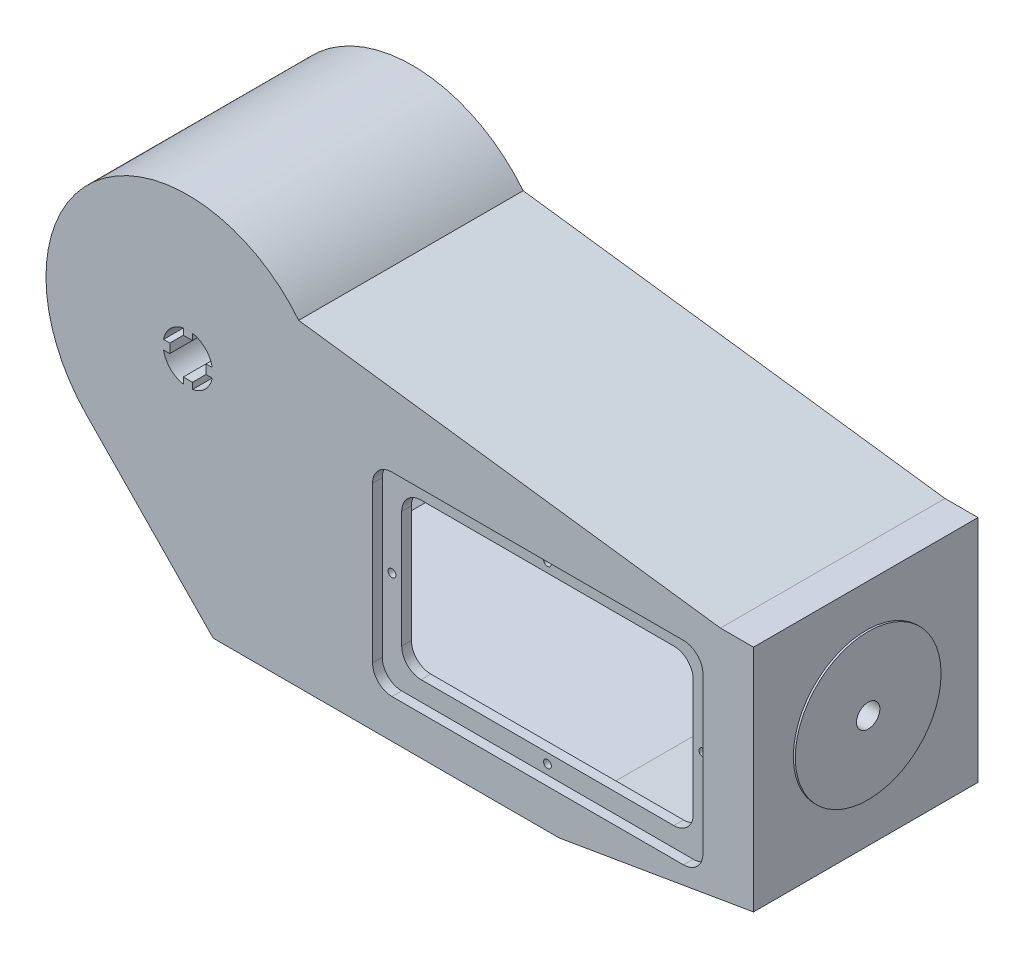
from build123d import *

# Parameters (mm, degrees)
RESSALTO_EXTRUS_O1_DEPTH = 57.75
ESBO_O2_R                = 37.5
RESSALTO_EXTRUS_O2_DEPTH = 1
CORTE_EXTRUS_O1_DEPTH    = 336.452306595
CASCA1_START             = -47.75
CASCA1_OUTLINE_R         = 22.75
CASCA1_DEPTH             = 95.5
CASCA1_START_2           = 281
CASCA1_2_OUTLINE_R       = 27.5
CASCA1_2_DEPTH           = 1
CORTE_EXTRUS_O2_REACH    = 389.923
ESBO_O6_R                = 6
CORTE_EXTRUS_O3_REACH    = 337.452
CORTE_EXTRUS_O4_DEPTH    = 5
ESBO_O9_R                = 2
CORTE_EXTRUS_O5_DEPTH    = 5


with BuildPart() as part:
    # Esboço1 → Ressalto-extrusão1 (new, symmetric)
    with BuildSketch(Plane.XY):
        with BuildLine():
            Line((291, 0), (291, 17))
            Line((291, 17), (274, 17))
            Line((274, 17), (57, 45.607017004))
            ThreePointArc((57, 45.607017004), (-48.32227677, 54.71706834), (-52.304922539, -50.92342367))
            Line((-52.304922539, -50.92342367), (13, -118))
            Line((13, -118), (191, -118))
            Line((191, -118), (291, -101))
            Line((291, -101), (291, 0))
        make_face()
    extrude(amount=RESSALTO_EXTRUS_O1_DEPTH, both=True)

    # Esboço2 → Ressalto-extrusão2 (add, symmetric)
    with BuildSketch(Plane(origin=(291, 0, 0), x_dir=(0, 0, -1), z_dir=(1, 0, 0))):
        with Locations(Location((0.25, -42, 0), (0, 0, 180))):
            Circle(ESBO_O2_R)
    extrude(amount=RESSALTO_EXTRUS_O2_DEPTH, both=True)

    # Esboço4 → Corte-extrusão1 (cut, through all)
    with BuildSketch(Plane(origin=(0, 0, -57.75), x_dir=(-1, 0, 0), z_dir=(0, 0, -1))):
        with BuildLine():
            Line((-2.35, 9.3), (2.35, 9.3))
            Line((2.35, 9.3), (2.35, 12.531560158))
            ThreePointArc((2.35, 12.531560158), (9.01561146, 9.01561146), (12.531560158, 2.35))
            Line((12.531560158, 2.35), (9.3, 2.35))
            Line((9.3, 2.35), (9.3, -2.35))
            Line((9.3, -2.35), (12.531560158, -2.35))
            ThreePointArc((12.531560158, -2.35), (9.01561146, -9.01561146), (2.35, -12.531560158))
            Line((2.35, -12.531560158), (2.35, -9.3))
            Line((2.35, -9.3), (-2.35, -9.3))
            Line((-2.35, -9.3), (-2.35, -12.531560158))
            ThreePointArc((-2.35, -12.531560158), (-9.01561146, -9.01561146), (-12.531560158, -2.35))
            Line((-12.531560158, -2.35), (-9.3, -2.35))
            Line((-9.3, -2.35), (-9.3, 2.35))
            Line((-9.3, 2.35), (-12.531560158, 2.35))
            ThreePointArc((-12.531560158, 2.35), (-9.01561146, 9.01561146), (-2.35, 12.531560158))
            Line((-2.35, 12.531560158), (-2.35, 9.3))
        make_face()
    extrude(amount=-CORTE_EXTRUS_O1_DEPTH, mode=Mode.SUBTRACT)

    # Casca1: read off the stored shape, not the designer's step
    # Casca1 outline → Casca1 (cut)
    with BuildSketch(Plane.XY.offset(CASCA1_START)):
        with BuildLine():
            ThreePointArc((51.532195013, 36.241314506), (-40.221654164, 48.489365187), (-45.139864657, -43.947612208))
            Line((-45.139864657, -43.947612208), (17.22074544, -108))
            Line((17.22074544, -108), (190.15605408, -108))
            Line((190.15605408, -108), (281, -92.556529194))
            Line((281, -92.556529194), (281, 7))
            Line((281, 7), (273.343691363, 7))
            Line((273.343691363, 7), (51.532195013, 36.241314506))
        make_face()
        Circle(CASCA1_OUTLINE_R, mode=Mode.SUBTRACT)
    extrude(amount=CASCA1_DEPTH, mode=Mode.SUBTRACT)

    # Casca1 2 outline → Casca1 2 (cut)
    with BuildSketch(Plane.YZ.offset(CASCA1_START_2)):
        with Locations((-42, -0.25)):
            Circle(CASCA1_2_OUTLINE_R)
    extrude(amount=CASCA1_2_DEPTH, mode=Mode.SUBTRACT)

    # Esboço6 → Corte-extrusão2 (cut, up to next)
    with BuildSketch(Plane(origin=(292, 0, 0), x_dir=(0, 0, -1), z_dir=(1, 0, 0)), mode=Mode.PRIVATE) as corte_extrus_o2_sk1:
        with Locations((0.25, -42)):
            Circle(ESBO_O6_R)
    corte_extrus_o2_tool1 = extrude(corte_extrus_o2_sk1.sketch, amount=-CORTE_EXTRUS_O2_REACH, mode=Mode.PRIVATE) & part.part
    add(corte_extrus_o2_tool1.solids().sort_by_distance((292, -42, -0.25))[0], mode=Mode.SUBTRACT)

    # Esboço7 → Corte-extrusão3 (cut, up to next)
    with BuildSketch(Plane.XY.offset(57.75), mode=Mode.PRIVATE) as corte_extrus_o3_sk1:
        with BuildLine():
            Line((245, -88), (115, -88))
            ThreePointArc((115, -88), (107.928932188, -85.071067812), (105, -78))
            Line((105, -78), (105, -18))
            ThreePointArc((105, -18), (107.928932188, -10.928932188), (115, -8))
            Line((115, -8), (245, -8))
            ThreePointArc((245, -8), (252.071067812, -10.928932188), (255, -18))
            Line((255, -18), (255, -78))
            ThreePointArc((255, -78), (252.071067812, -85.071067812), (245, -88))
        make_face()
    corte_extrus_o3_tool1 = extrude(corte_extrus_o3_sk1.sketch, amount=-CORTE_EXTRUS_O3_REACH, mode=Mode.PRIVATE) & part.part
    add(corte_extrus_o3_tool1.solids().sort_by_distance((180, -48, 57.75))[0], mode=Mode.SUBTRACT)

    # Esboço8 → Corte-extrusão4 (cut)
    with BuildSketch(Plane.XY.offset(57.75)):
        with BuildLine():
            Line((255, -98), (105, -98))
            ThreePointArc((105, -98), (97.928932188, -95.071067812), (95, -88))
            Line((95, -88), (95, -8))
            ThreePointArc((95, -8), (97.928932188, -0.928932188), (105, 2))
            Line((105, 2), (255, 2))
            ThreePointArc((255, 2), (262.071067812, -0.928932188), (265, -8))
            Line((265, -8), (265, -88))
            ThreePointArc((265, -88), (262.071067812, -95.071067812), (255, -98))
        make_face()
    extrude(amount=-CORTE_EXTRUS_O4_DEPTH, mode=Mode.SUBTRACT)

    # Esboço9 → Corte-extrusão5 (cut)
    with BuildSketch(Plane.XY.offset(52.75)):
        with Locations((180, -3)):
            Circle(ESBO_O9_R)
        with Locations((260, -48)):
            Circle(ESBO_O9_R)
        with Locations((180, -93)):
            Circle(ESBO_O9_R)
        with Locations((99.997152321, -48)):
            Circle(ESBO_O9_R)
    extrude(amount=-CORTE_EXTRUS_O5_DEPTH, mode=Mode.SUBTRACT)


solid = part.part
